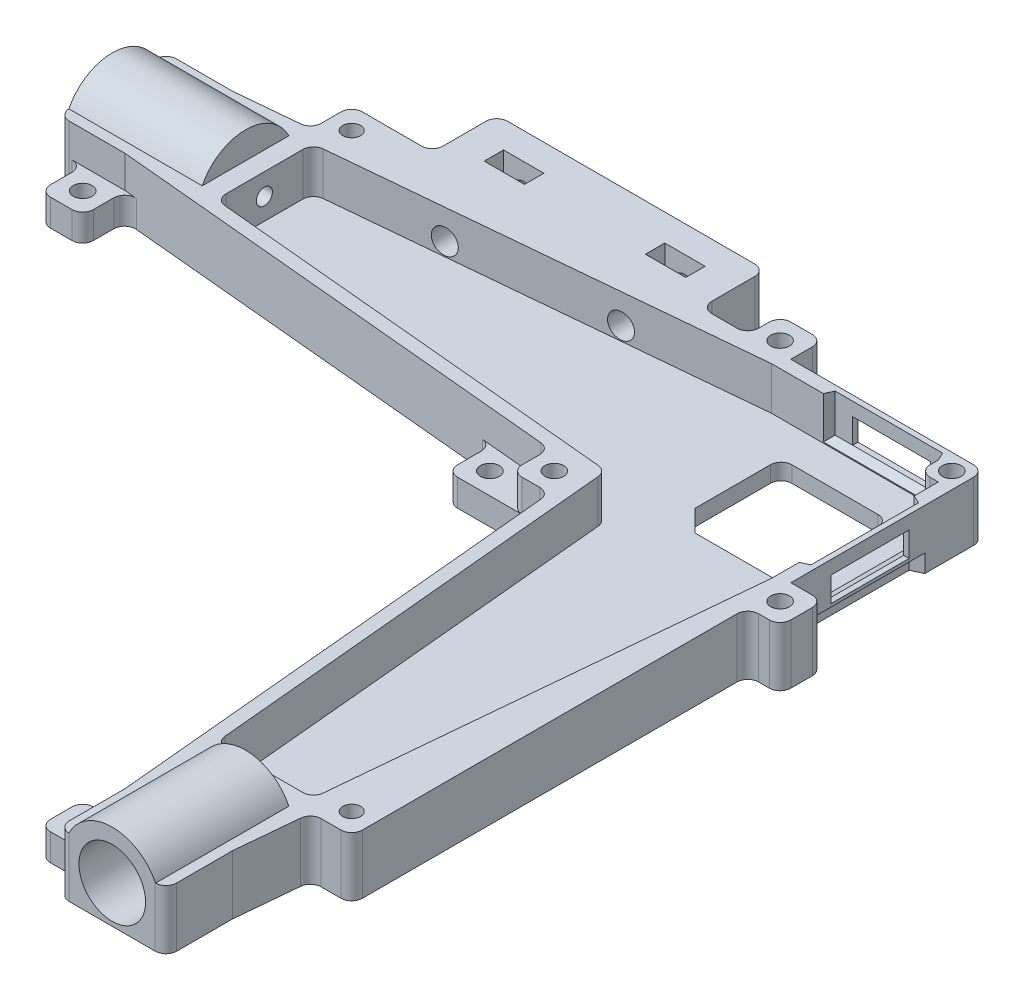
from build123d import *
from OCP.BRepFilletAPI import BRepFilletAPI_MakeChamfer

# Parameters (mm, degrees)
BOSS_EXTRUDE3_DEPTH            = 8
BOSS_EXTRUDE3_2_DEPTH          = 8
BOSS_EXTRUDE4_DEPTH            = 3
SKETCH18_W                     = 132.616225526
SKETCH18_H                     = 11
CUT_EXTRUDE4_DEPTH             = 1.5
SKETCH20_W                     = 131.116225526
SKETCH20_H                     = 11
CUT_EXTRUDE6_DEPTH             = 1.5
BOSS_EXTRUDE7_DEPTH            = 1.5
BOSS_EXTRUDE8_DEPTH            = 1.5
SKETCH17_W                     = 14.5
SKETCH17_H                     = 4.6
CUT_EXTRUDE3_DEPTH             = 202.646968735
CUT_EXTRUDE3_DIRECTION_2_REACH = 203.647
SKETCH19_W                     = 14.5
SKETCH19_H                     = 4.6
CUT_EXTRUDE5_DEPTH             = 202.646968735
CUT_EXTRUDE5_DIRECTION_2_REACH = 203.647
CUT_EXTRUDE7_START             = -1.5
SKETCH23_W                     = 20
SKETCH23_H                     = 4.6
CUT_EXTRUDE7_DEPTH             = 1.5
CUT_EXTRUDE9_START             = -1.5
SKETCH25_W                     = 20
SKETCH25_H                     = 4.6
CUT_EXTRUDE9_DEPTH             = 1.5
CHAMFER2_SIZE                  = 1.5
CHAMFER2_SIZE_2                = 0.699461487
SKETCH28_W                     = 18.5
SKETCH28_H                     = 2.4
CUT_EXTRUDE10_DEPTH            = 2
SKETCH29_W                     = 18.5
SKETCH29_H                     = 2.4
CUT_EXTRUDE11_DEPTH            = 2
CHAMFER3_SIZE                  = 0.932615316
CHAMFER3_SIZE_2                = 2
SKETCH30_W                     = 20
SKETCH30_H                     = 20
CUT_EXTRUDE12_DEPTH            = 202.684159021
FILLET1_R                      = 2
BOSS_EXTRUDE11_DEPTH           = 11
SKETCH35_R                     = 1.65
CUT_EXTRUDE13_DEPTH            = 202.825419608
CHAMFER5_SIZE                  = 4
CUT_EXTRUDE14_DEPTH            = 202.704610755
BOSS_EXTRUDE14_DEPTH           = 8
BOSS_EXTRUDE15_DEPTH           = 24.798408621
CUT_EXTRUDE22_DEPTH            = 8.18
CUT_EXTRUDE22_DEPTH_BACK       = 194.773708227
SKETCH41_R                     = 6.2
SKETCH47_R                     = 1.5
CUT_EXTRUDE24_DEPTH            = 15.799083948
BOSS_EXTRUDE16_DEPTH           = 8
BOSS_EXTRUDE17_DEPTH           = 24.798408621
CUT_EXTRUDE25_DEPTH            = 194.773708227
CUT_EXTRUDE25_DEPTH_BACK       = 8.18
SKETCH51_R                     = 6.2
SKETCH52_R                     = 1.5
CUT_EXTRUDE26_DEPTH            = 15.799083948
SKETCH53_W                     = 50
SKETCH53_H                     = 12
BOSS_EXTRUDE18_DEPTH           = 11
CUT_EXTRUDE27_REACH            = 213.11
SKETCH56_R                     = 2.3
CUT_EXTRUDE28_START            = -5
CUT_EXTRUDE28_DEPTH            = 3.6
SKETCH58_W                     = 6.050538513
SKETCH58_H                     = 6.050538513
SKETCH58_W_2                   = 8
SKETCH58_H_2                   = 6
SKETCH58_W_3                   = 6
SKETCH58_H_3                   = 8
BOSS_EXTRUDE19_DEPTH           = 11
BOSS_EXTRUDE20_DEPTH           = 5
SKETCH64_R                     = 1.75
CUT_EXTRUDE31_DEPTH            = 203.159590423
FILLET4_R                      = 2
SKETCH59_R                     = 1.75
CUT_EXTRUDE29_DEPTH            = 203.159590572
CUT_EXTRUDE30_DEPTH            = 2.5
CUT_EXTRUDE30_DRAFT            = -5
CUT_EXTRUDE30_PROFILE_2_DEPTH  = 2.5
CUT_EXTRUDE30_PROFILE_2_DRAFT  = -5


# Some blends are built 0.0001 mm under size
with BuildPart() as part:
    # Sketch10 → Boss-Extrude3 (new body)
    with BuildSketch(Plane(origin=(0, -4, 0), x_dir=(1, 0, 0), z_dir=(0, 1, 0))):
        Polygon((0, 0), (-20, 0), (-130, -10.25), (-140, -10.25), (-142.5, -10.25), (-142.5, -7.75), (-130.116225526, -7.75), (-20.116225526, 2.5), (2.5, 2.5), (2.5, -20.116225526), (-7.75, -130.116225526), (-7.75, -142.5), (-10.25, -142.5), (-10.25, -140), (-10.25, -130), (0, -20), align=None)
    extrude(amount=BOSS_EXTRUDE3_DEPTH)



with BuildPart() as body_2:
    # Sketch10 → Boss-Extrude3 2 (new body)
    with BuildSketch(Plane(origin=(0, -4, 0), x_dir=(1, 0, 0), z_dir=(0, 1, 0))):
        Polygon((-140, -25.25), (-130, -25.25), (-34.178794179, -34.178794179), (-25.25, -130), (-25.25, -140), (-25.25, -142.5), (-27.75, -142.5), (-27.75, -130.116225526), (-36.475603423, -36.475603423), (-130.116225526, -27.75), (-142.5, -27.75), (-142.5, -25.25), align=None)
    extrude(amount=BOSS_EXTRUDE3_2_DEPTH)


with BuildPart() as part_1:
    add(part.part)

    add(body_2.part)  # Boss-Extrude4 merges body 2
    # Sketch12 → Boss-Extrude4 (add)
    with BuildSketch(Plane(origin=(0, -4, 0), x_dir=(1, 0, 0), z_dir=(0, 1, 0))):
        Polygon((-142.5, -10.25), (-142.5, -25.25), (-142.5, -27.75), (-130.116225526, -27.75), (-36.475603423, -36.475603423), (-27.75, -130.116225526), (-27.75, -142.5), (-25.25, -142.5), (-10.25, -142.5), (-7.75, -142.5), (-7.75, -130.116225526), (2.5, -20.116225526), (2.5, 2.5), (-20.116225526, 2.5), (-130.116225526, -7.75), (-142.5, -7.75), align=None)
    extrude(amount=-BOSS_EXTRUDE4_DEPTH)

    # Sketch18 → Cut-Extrude4 (cut)
    with BuildSketch(Plane(origin=(0, 0, -2.5), x_dir=(-1, 0, 0), z_dir=(0, 0, -1))):
        with Locations((63.808112763, -1.5)):
            Rectangle(SKETCH18_W, SKETCH18_H)
    extrude(amount=-CUT_EXTRUDE4_DEPTH, mode=Mode.SUBTRACT)

    # Sketch20 → Cut-Extrude6 (cut)
    with BuildSketch(Plane(origin=(2.5, 0, 0), x_dir=(0, 0, -1), z_dir=(1, 0, 0))):
        with Locations((-64.558112763, -1.5)):
            Rectangle(SKETCH20_W, SKETCH20_H)
    extrude(amount=-CUT_EXTRUDE6_DEPTH, mode=Mode.SUBTRACT)

    # Sketch21 → Boss-Extrude7 (add)
    with BuildSketch(Plane.XY):
        Polygon((-20, -4), (-46.945493818, -4), (-46.945493818, 4), (-20, 4), (0, 4), (0, -4), align=None)
    extrude(amount=BOSS_EXTRUDE7_DEPTH)

    # Sketch22 → Boss-Extrude8 (add)
    with BuildSketch(Plane.ZY):
        Polygon((20, -4), (46.945493818, -4), (46.945493818, 4), (20, 4), (1.5, 4), (1.5, -4), align=None)
    extrude(amount=BOSS_EXTRUDE8_DEPTH)

    # Sketch17 → Cut-Extrude3 (cut)
    with BuildSketch(Plane.XY):
        with Locations((-15.25, -0.8)):
            Rectangle(SKETCH17_W, SKETCH17_H)
    extrude(amount=-CUT_EXTRUDE3_DEPTH, mode=Mode.SUBTRACT)

    # Sketch17 → Cut-Extrude3 direction 2 (cut, up to next)
    with BuildSketch(Plane.XY, mode=Mode.PRIVATE) as cut_extrude3_direction_2_sk1:
        with Locations((-15.25, -0.8)):
            Rectangle(SKETCH17_W, SKETCH17_H)
    cut_extrude3_direction_2_tool1 = extrude(cut_extrude3_direction_2_sk1.sketch, amount=CUT_EXTRUDE3_DIRECTION_2_REACH, mode=Mode.PRIVATE) & part_1.part
    add(cut_extrude3_direction_2_tool1.solids().sort_by_distance((-15.25, -0.8, 0))[0], mode=Mode.SUBTRACT)

    # Sketch19 → Cut-Extrude5 (cut)
    with BuildSketch(Plane(origin=(0, 0, 0), x_dir=(0, 0, -1), z_dir=(1, 0, 0))):
        with Locations((-20.25, -0.8)):
            Rectangle(SKETCH19_W, SKETCH19_H)
    extrude(amount=CUT_EXTRUDE5_DEPTH, mode=Mode.SUBTRACT)

    # Sketch19 → Cut-Extrude5 direction 2 (cut, up to next)
    with BuildSketch(Plane(origin=(0, 0, 0), x_dir=(0, 0, -1), z_dir=(1, 0, 0)), mode=Mode.PRIVATE) as cut_extrude5_direction_2_sk1:
        with Locations((-20.25, -0.8)):
            Rectangle(SKETCH19_W, SKETCH19_H)
    cut_extrude5_direction_2_tool1 = extrude(cut_extrude5_direction_2_sk1.sketch, amount=-CUT_EXTRUDE5_DIRECTION_2_REACH, mode=Mode.PRIVATE) & part_1.part
    add(cut_extrude5_direction_2_tool1.solids().sort_by_distance((0, -0.8, 20.25))[0], mode=Mode.SUBTRACT)

    # Sketch23 → Cut-Extrude7 (cut)
    with BuildSketch(Plane.ZY.offset(1.5).offset(CUT_EXTRUDE7_START)):
        with Locations((20.25, -0.8)):
            Rectangle(SKETCH23_W, SKETCH23_H)
    extrude(amount=CUT_EXTRUDE7_DEPTH, mode=Mode.SUBTRACT)

    # Sketch25 → Cut-Extrude9 (cut)
    with BuildSketch(Plane(origin=(-36, 0, 1.5), x_dir=(1, 0, 0), z_dir=(0, 0, 1)).offset(CUT_EXTRUDE9_START)):
        with Locations((20.25, -0.8)):
            Rectangle(SKETCH25_W, SKETCH25_H)
    extrude(amount=CUT_EXTRUDE9_DEPTH, mode=Mode.SUBTRACT)

    # Chamfer2
    chamfer2_edges_1 = [part_1.edges().sort_by_distance(p)[0] for p in [
        (-1.5, -3.1, 20.25),
    ]]
    chamfer2_side_1 = [part_1.faces().sort_by_distance(p)[0] for p in [
        (-1.48601077, -3.1, 20.25),
    ]]
    chamfer2_edges_2 = [part_1.edges().sort_by_distance(p)[0] for p in [
        (-1.5, -0.8, 30.25),
    ]]
    chamfer2_side_2 = [part_1.faces().sort_by_distance(p)[0] for p in [
        (-1.48601077, -0.8, 30.25),
    ]]
    chamfer2_edges_3 = [part_1.edges().sort_by_distance(p)[0] for p in [
        (-1.5, -0.8, 10.25),
    ]]
    chamfer2_side_3 = [part_1.faces().sort_by_distance(p)[0] for p in [
        (-1.48601077, -0.8, 10.25),
    ]]
    chamfer2_edges_4 = [part_1.edges().sort_by_distance(p)[0] for p in [
        (-15.75, -3.1, 1.5),
    ]]
    chamfer2_side_4 = [part_1.faces().sort_by_distance(p)[0] for p in [
        (-15.75, -3.1, 1.48601077),
    ]]
    chamfer2_edges_5 = [part_1.edges().sort_by_distance(p)[0] for p in [
        (-5.75, -0.8, 1.5),
    ]]
    chamfer2_side_5 = [part_1.faces().sort_by_distance(p)[0] for p in [
        (-5.75, -0.8, 1.48601077),
    ]]
    chamfer2_edges_6 = [part_1.edges().sort_by_distance(p)[0] for p in [
        (-25.75, -0.8, 1.5),
    ]]
    chamfer2_side_6 = [part_1.faces().sort_by_distance(p)[0] for p in [
        (-25.75, -0.8, 1.48601077),
    ]]
    chamfer2 = BRepFilletAPI_MakeChamfer(part_1.part.solid().wrapped)
    for e in chamfer2_edges_1:
        chamfer2.Add(CHAMFER2_SIZE - 0.0001, CHAMFER2_SIZE_2 - 0.0001, e.wrapped, chamfer2_side_1[0].wrapped)
    for e in chamfer2_edges_2:
        chamfer2.Add(CHAMFER2_SIZE - 0.0001, CHAMFER2_SIZE_2 - 0.0001, e.wrapped, chamfer2_side_2[0].wrapped)
    for e in chamfer2_edges_3:
        chamfer2.Add(CHAMFER2_SIZE - 0.0001, CHAMFER2_SIZE_2 - 0.0001, e.wrapped, chamfer2_side_3[0].wrapped)
    for e in chamfer2_edges_4:
        chamfer2.Add(CHAMFER2_SIZE - 0.0001, CHAMFER2_SIZE_2 - 0.0001, e.wrapped, chamfer2_side_4[0].wrapped)
    for e in chamfer2_edges_5:
        chamfer2.Add(CHAMFER2_SIZE - 0.0001, CHAMFER2_SIZE_2 - 0.0001, e.wrapped, chamfer2_side_5[0].wrapped)
    for e in chamfer2_edges_6:
        chamfer2.Add(CHAMFER2_SIZE - 0.0001, CHAMFER2_SIZE_2 - 0.0001, e.wrapped, chamfer2_side_6[0].wrapped)
    add(Compound.cast(chamfer2.Shape()), mode=Mode.REPLACE)  # a hair under: the kernel refuses the full size

    # Sketch28 → Cut-Extrude10 (cut)
    with BuildSketch(Plane(origin=(0, 0, -1), x_dir=(-1, 0, 0), z_dir=(0, 0, -1))):
        with Locations((15.25, -5.8)):
            Rectangle(SKETCH28_W, SKETCH28_H)
    extrude(amount=-CUT_EXTRUDE10_DEPTH, mode=Mode.SUBTRACT)

    # Sketch29 → Cut-Extrude11 (cut)
    with BuildSketch(Plane(origin=(1, 0, 5), x_dir=(0, 0, 1), z_dir=(-1, 0, 0))):
        with Locations((15.25, -5.8)):
            Rectangle(SKETCH29_W, SKETCH29_H)
    extrude(amount=CUT_EXTRUDE11_DEPTH, mode=Mode.SUBTRACT)

    # Chamfer3
    chamfer3_edges_1 = [part_1.edges().sort_by_distance(p)[0] for p in [
        (-24.5, -5.8, -1),
    ]]
    chamfer3_side_1 = [part_1.faces().sort_by_distance(p)[0] for p in [
        (-24.518652306, -5.8, -1),
    ]]
    chamfer3_edges_2 = [part_1.edges().sort_by_distance(p)[0] for p in [
        (-15.25, -4.6, -1),
    ]]
    chamfer3_side_2 = [part_1.faces().sort_by_distance(p)[0] for p in [
        (-15.25, -4.581347694, -1),
    ]]
    chamfer3_edges_3 = [part_1.edges().sort_by_distance(p)[0] for p in [
        (-6, -5.8, -1),
    ]]
    chamfer3_side_3 = [part_1.faces().sort_by_distance(p)[0] for p in [
        (-5.981347694, -5.8, -1),
    ]]
    chamfer3_edges_4 = [part_1.edges().sort_by_distance(p)[0] for p in [
        (1, -5.8, 11),
    ]]
    chamfer3_side_4 = [part_1.faces().sort_by_distance(p)[0] for p in [
        (1, -5.8, 10.981347694),
    ]]
    chamfer3_edges_5 = [part_1.edges().sort_by_distance(p)[0] for p in [
        (1, -5.8, 29.5),
    ]]
    chamfer3_side_5 = [part_1.faces().sort_by_distance(p)[0] for p in [
        (1, -5.8, 29.518652306),
    ]]
    chamfer3_edges_6 = [part_1.edges().sort_by_distance(p)[0] for p in [
        (1, -4.6, 20.25),
    ]]
    chamfer3_side_6 = [part_1.faces().sort_by_distance(p)[0] for p in [
        (1, -4.581347694, 20.25),
    ]]
    chamfer3 = BRepFilletAPI_MakeChamfer(part_1.part.solid().wrapped)
    for e in chamfer3_edges_1:
        chamfer3.Add(CHAMFER3_SIZE - 0.0001, CHAMFER3_SIZE_2 - 0.0001, e.wrapped, chamfer3_side_1[0].wrapped)
    for e in chamfer3_edges_2:
        chamfer3.Add(CHAMFER3_SIZE - 0.0001, CHAMFER3_SIZE_2 - 0.0001, e.wrapped, chamfer3_side_2[0].wrapped)
    for e in chamfer3_edges_3:
        chamfer3.Add(CHAMFER3_SIZE - 0.0001, CHAMFER3_SIZE_2 - 0.0001, e.wrapped, chamfer3_side_3[0].wrapped)
    for e in chamfer3_edges_4:
        chamfer3.Add(CHAMFER3_SIZE - 0.0001, CHAMFER3_SIZE_2 - 0.0001, e.wrapped, chamfer3_side_4[0].wrapped)
    for e in chamfer3_edges_5:
        chamfer3.Add(CHAMFER3_SIZE - 0.0001, CHAMFER3_SIZE_2 - 0.0001, e.wrapped, chamfer3_side_5[0].wrapped)
    for e in chamfer3_edges_6:
        chamfer3.Add(CHAMFER3_SIZE - 0.0001, CHAMFER3_SIZE_2 - 0.0001, e.wrapped, chamfer3_side_6[0].wrapped)
    add(Compound.cast(chamfer3.Shape()), mode=Mode.REPLACE)  # a hair under: the kernel refuses the full size

    # Sketch30 → Cut-Extrude12 (cut, through all)
    with BuildSketch(Plane(origin=(0, -4, 0), x_dir=(1, 0, 0), z_dir=(0, 1, 0))):
        with Locations((-17.899660586, -17.899660586)):
            Rectangle(SKETCH30_W, SKETCH30_H)
    extrude(amount=-CUT_EXTRUDE12_DEPTH, mode=Mode.SUBTRACT)

    # Fillet1
    fillet1_edges = [part_1.edges().sort_by_distance(p)[0] for p in [
        (-27.899660586, -5.5, 7.899660586),
        (-7.899660586, -5.5, 7.899660586),
        (-7.899660586, -5.5, 27.899660586),
    ]]
    fillet(fillet1_edges, radius=FILLET1_R)

    # Sketch33 → Boss-Extrude11 (add)
    with BuildSketch(Plane.XZ.offset(7)):
        Polygon((-36.213786501, -1), (-116.701591379, -1), (-116.701591379, 6.5), align=None)
        Polygon((1, 116.701591379), (-6.5, 116.701591379), (1, 36.213786501), align=None)
    extrude(amount=-BOSS_EXTRUDE11_DEPTH)

    # Sketch35 → Cut-Extrude13 (cut, through all)
    with BuildSketch(Plane(origin=(0, 4, 0), x_dir=(1, 0, 0), z_dir=(0, 1, 0))):
        with Locations(Location((-112.701591379, -3, 0), (0, 0, 270))):
            Circle(SKETCH35_R)
        with Locations(Location((-3, -112.701591379, 0), (0, 0, 90))):
            Circle(SKETCH35_R)
    extrude(amount=-CUT_EXTRUDE13_DEPTH, mode=Mode.SUBTRACT)

    # Chamfer5
    chamfer5_edges = [part_1.edges().sort_by_distance(p)[0] for p in [
        (-27.899660586, -5.5, 27.899660586),
    ]]
    chamfer(chamfer5_edges, length=CHAMFER5_SIZE)

    # Sketch37 → Cut-Extrude14 (cut, through all)
    with BuildSketch(Plane.XZ.offset(-1.5)):
        Polygon((0, 27.5), (0, 30.25), (-1.5, 30.949461487), (-1.5, 9.550538513), (0, 10.25), (0, 13), align=None)
        Polygon((-25.75, 0), (-22.5, 0), (-8, 0), (-5.75, 0), (-5.050538513, 1.5), (-26.449461487, 1.5), align=None)
    extrude(amount=-CUT_EXTRUDE14_DEPTH, mode=Mode.SUBTRACT)

    # Sketch44 → Boss-Extrude14 (add)
    with BuildSketch(Plane(origin=(0, -4, 0), x_dir=(1, 0, 0), z_dir=(0, 1, 0))):
        Polygon((-114.200916052, -8.777812632), (-114.200916052, -26.722187368), (-130, -25.25), (-142.5, -25.25), (-142.5, -10.25), (-130, -10.25), align=None)
    extrude(amount=BOSS_EXTRUDE14_DEPTH)

    # Sketch46 → Boss-Extrude15 (add)
    with BuildSketch(Plane.ZY.offset(142.5)):
        with BuildLine():
            Line((9.687742252, 4), (25.812257748, 4))
            ThreePointArc((25.812257748, 4), (17.75, 9), (9.687742252, 4))
        make_face()
    extrude(amount=-BOSS_EXTRUDE15_DEPTH)

    # Sketch41 → Cut-Extrude22 (cut, two sides: drawn at the far end of the back side and taken through both)
    with BuildSketch(Plane(origin=(-130, 0, 0), x_dir=(0, 0, -1), z_dir=(1, 0, 0)).offset(-CUT_EXTRUDE22_DEPTH_BACK)):
        with Locations((-17.75, 0)):
            Circle(SKETCH41_R)
    extrude(amount=CUT_EXTRUDE22_DEPTH + CUT_EXTRUDE22_DEPTH_BACK, mode=Mode.SUBTRACT)

    # Sketch47 → Cut-Extrude24 (cut)
    with BuildSketch(Plane(origin=(-130, 0, 0), x_dir=(0, 0, -1), z_dir=(1, 0, 0))):
        with Locations(Location((-17.75, 0, 0), (0, 0, 180))):
            Circle(SKETCH47_R)
    extrude(amount=CUT_EXTRUDE24_DEPTH, mode=Mode.SUBTRACT)

    # Sketch48 → Boss-Extrude16 (add)
    with BuildSketch(Plane(origin=(0, -4, 0), x_dir=(1, 0, 0), z_dir=(0, 1, 0))):
        Polygon((-25.25, -142.5), (-10.25, -142.5), (-10.25, -130), (-8.777812632, -114.200916052), (-26.722187368, -114.200916052), (-25.25, -130), align=None)
    extrude(amount=BOSS_EXTRUDE16_DEPTH)

    # Sketch49 → Boss-Extrude17 (add)
    with BuildSketch(Plane.XY.offset(142.5)):
        with BuildLine():
            Line((-25.812257748, 4), (-9.687742252, 4))
            ThreePointArc((-9.687742252, 4), (-17.75, 9), (-25.812257748, 4))
        make_face()
    extrude(amount=-BOSS_EXTRUDE17_DEPTH)

    # Sketch51 → Cut-Extrude25 (cut, two sides: drawn at the far end of the back side and taken through both)
    with BuildSketch(Plane.XY.offset(130).offset(-CUT_EXTRUDE25_DEPTH_BACK)):
        with Locations((-17.75, 0)):
            Circle(SKETCH51_R)
    extrude(amount=CUT_EXTRUDE25_DEPTH + CUT_EXTRUDE25_DEPTH_BACK, mode=Mode.SUBTRACT)

    # Sketch52 → Cut-Extrude26 (cut)
    with BuildSketch(Plane.XY.offset(130)):
        with Locations((-17.75, 0)):
            Circle(SKETCH52_R)
    extrude(amount=-CUT_EXTRUDE26_DEPTH, mode=Mode.SUBTRACT)

    # Sketch53 → Boss-Extrude18 (add)
    with BuildSketch(Plane.XZ.offset(7)):
        with Locations((-76.701591379, -7)):
            Rectangle(SKETCH53_W, SKETCH53_H)
    extrude(amount=-BOSS_EXTRUDE18_DEPTH)

    # Cut-Extrude27: up to this plane
    cut_extrude27_end = Plane(origin=(-20, 209.060966544, 0), z_dir=(-0.09277989176383615, 0, -0.9956866433192176))
    # Sketch56 → Cut-Extrude27 (cut, up to the surface)
    with BuildSketch(Plane(origin=(0, 0, -13), x_dir=(-1, 0, 0), z_dir=(0, 0, -1)), mode=Mode.PRIVATE) as cut_extrude27_sk1:
        with Locations((61.701591379, -1.5)):
            Circle(SKETCH56_R)
    cut_extrude27_tool1 = split(extrude(cut_extrude27_sk1.sketch, amount=-CUT_EXTRUDE27_REACH, mode=Mode.PRIVATE), bisect_by=cut_extrude27_end, keep=Keep.BOTH, mode=Mode.PRIVATE)
    add(cut_extrude27_tool1.solids().sort_by_distance((-61.701591, -1.5, -13))[0], mode=Mode.SUBTRACT)
    # Sketch56 → Cut-Extrude27 (cut, up to the surface)
    with BuildSketch(Plane(origin=(0, 0, -13), x_dir=(-1, 0, 0), z_dir=(0, 0, -1)), mode=Mode.PRIVATE) as cut_extrude27_sk2:
        with Locations(Location((91.701591379, -1.5, 0), (0, 0, 180))):
            Circle(SKETCH56_R)
    cut_extrude27_tool2 = split(extrude(cut_extrude27_sk2.sketch, amount=-CUT_EXTRUDE27_REACH, mode=Mode.PRIVATE), bisect_by=cut_extrude27_end, keep=Keep.BOTH, mode=Mode.PRIVATE)
    add(cut_extrude27_tool2.solids().sort_by_distance((-91.701591, -1.5, -13))[0], mode=Mode.SUBTRACT)

    # Sketch57 → Cut-Extrude28 (cut)
    with BuildSketch(Plane(origin=(0, 0, -13), x_dir=(-1, 0, 0), z_dir=(0, 0, -1)).offset(CUT_EXTRUDE28_START)):
        Polygon((57.951591379, 0.665063509), (57.951591379, 4), (65.451591379, 4), (65.451591379, 0.665063509), (65.451591379, -3.665063509), (61.701591379, -5.830127019), (57.951591379, -3.665063509), align=None)
        Polygon((87.951591379, 4), (87.951591379, 0.665063509), (87.951591379, -3.665063509), (91.701591379, -5.830127019), (95.451591379, -3.665063509), (95.451591379, 0.665063509), (95.451591379, 4), align=None)
    extrude(amount=-CUT_EXTRUDE28_DEPTH, mode=Mode.SUBTRACT)

    # Sketch58 → Boss-Extrude19 (add)
    with BuildSketch(Plane(origin=(0, -7, 0), x_dir=(-1, 0, 0), z_dir=(0, -1, 0))):
        with Locations((2.025269257, -2.025269257)):
            Rectangle(SKETCH58_W, SKETCH58_H)
        with Locations((39, 4)):
            Rectangle(SKETCH58_W_2, SKETCH58_H_2)
        Polygon((43, -35.867648288), (36.475603423, -36.475603423), (35.867648288, -43), (43, -43), align=None)
        with Locations((-4, -39)):
            Rectangle(SKETCH58_W_3, SKETCH58_H_3)
    extrude(amount=-BOSS_EXTRUDE19_DEPTH)

    # Sketch62 → Boss-Extrude20 (add)
    with BuildSketch(Plane.XZ.offset(7)):
        Polygon((-43, 35.867648288), (-43, 43), (-55, 43), (-55, 34.749466469), align=None)
        Polygon((-138, 27.75), (-138, 35.75), (-130, 35.75), (-130, 27.760830106), (-130.116225526, 27.75), align=None)
        Polygon((-27.75, 130.116225526), (-27.75, 138), (-35.75, 138), (-35.75, 130), (-27.760830106, 130), align=None)
    extrude(amount=-BOSS_EXTRUDE20_DEPTH)

    # Sketch64 → Cut-Extrude31 (cut, through all)
    with BuildSketch(Plane.XZ.offset(7)):
        with Locations(Location((-134, 31.75, 0), (0, 0, 270))):
            Circle(SKETCH64_R)
        with Locations(Location((-51, 39, 0), (0, 0, 270))):
            Circle(SKETCH64_R)
        with Locations(Location((-31.75, 134, 0), (0, 0, 270))):
            Circle(SKETCH64_R)
    extrude(amount=-CUT_EXTRUDE31_DEPTH, mode=Mode.SUBTRACT)

    # Fillet4
    # the kernel refuses this fillet: 2 mm, written as the material it adds along each edge
    with BuildSketch(Plane(origin=(-116.701591379, -7, 6.5), x_dir=(0, 0, -1), z_dir=(0, 1, 0)), Plane(origin=(-6.5, -7, 116.701591379), x_dir=(-0.09277989176380903, 0, 0.9956866433192202), z_dir=(0, 1, 0)), Plane(origin=(-35.867648288, -7, 43), x_dir=(-1, 0, 0), z_dir=(0, 1, 0))) as fillet4_piece_1:
        with BuildLine():
            CenterArc((FILLET4_R * 0.911150224143, FILLET4_R), FILLET4_R, 185.323552552, 84.676447448)
            Line((-FILLET4_R * 0.0845364191766, FILLET4_R * 0.907220108236), (0, 0))
            Line((0, 0), (FILLET4_R * 0.911150224143, 0))
        make_face()
    extrude(amount=11)
    with BuildSketch(Plane(origin=(-114.200916052, -4, 8.777812632), x_dir=(0.9956866433192175, 0, -0.09277989176383705), z_dir=(0, 1, 0)), Plane(origin=(-114.200916052, -4, 26.722187368), x_dir=(0, 0, -1), z_dir=(0, 1, 0)), Plane(origin=(-8.777812632, -4, 114.200916052), x_dir=(-1, 0, 0), z_dir=(0, 1, 0)), Plane(origin=(-26.722187368, -4, 114.200916052), x_dir=(-0.09277989176383343, 0, -0.9956866433192179), z_dir=(0, 1, 0))) as fillet4_piece_2:
        with BuildLine():
            CenterArc((FILLET4_R * 0.911150224143, -FILLET4_R), FILLET4_R, 90, 84.676447448)
            Line((-FILLET4_R * 0.0845364191766, -FILLET4_R * 0.907220108236), (0, 0))
            Line((0, 0), (FILLET4_R * 0.911150224143, 0))
        make_face()
    extrude(amount=8)
    with BuildSketch(Plane(origin=(-51.701591379, -7, -1), x_dir=(0, 0, -1), z_dir=(0, 1, 0)), Plane(origin=(-101.701591379, -7, -1), x_dir=(-1, 0, 0), z_dir=(0, 1, 0)), Plane(origin=(-43, -7, -1), x_dir=(-1, 0, 0), z_dir=(0, 1, 0))) as fillet4_piece_3:
        with BuildLine():
            CenterArc((FILLET4_R, -FILLET4_R), FILLET4_R, 90, 90)
            Line((0, -FILLET4_R), (0, 0))
            Line((0, 0), (FILLET4_R, 0))
        make_face()
    extrude(amount=11)
    with BuildSketch(Plane(origin=(-43, -6.555751121, 35.867648288), x_dir=(-0.9956866433192175, 0, -0.0927798917638368), z_dir=(0, 1, 0))) as fillet4_piece_4:
        with BuildLine():
            CenterArc((FILLET4_R * 0.911150224143, FILLET4_R), FILLET4_R, 185.323552552, 84.676447448)
            Line((-FILLET4_R * 0.0845364191766, FILLET4_R * 0.907220108236), (0, 0))
            Line((0, 0), (FILLET4_R * 0.911150224143, 0))
        make_face()
    extrude(amount=10.555751121)
    with BuildSketch(Plane(origin=(1, -7, 43), x_dir=(0, 0, 1), z_dir=(0, 1, 0))) as fillet4_piece_5:
        with BuildLine():
            CenterArc((FILLET4_R, FILLET4_R), FILLET4_R, 180, 90)
            Line((0, FILLET4_R), (0, 0))
            Line((0, 0), (FILLET4_R, 0))
        make_face()
    extrude(amount=11)
    with BuildSketch(Plane(origin=(-55, -7, 34.749466469), x_dir=(-0.9956866433192179, 0, -0.09277989176383329), z_dir=(0, 1, 0))) as fillet4_piece_6:
        with BuildLine():
            CenterArc((FILLET4_R * 0.911150224143, FILLET4_R), FILLET4_R, 185.323552552, 84.676447448)
            Line((-FILLET4_R * 0.0845364191766, FILLET4_R * 0.907220108236), (0, 0))
            Line((0, 0), (FILLET4_R * 0.911150224143, 0))
        make_face()
    extrude(amount=5)
    with BuildSketch(Plane(origin=(-130.116225526, -2.232451052, 27.75), x_dir=(-1, 0, 0), z_dir=(0, 1, 0))) as fillet4_piece_7:
        with BuildLine():
            CenterArc((FILLET4_R * 0.0464902103115, FILLET4_R), FILLET4_R, 264.676447448, 5.323552552)
            Line((-FILLET4_R * 0.0462896814523, FILLET4_R * 0.00431335668078), (0, 0))
            Line((0, 0), (FILLET4_R * 0.0464902103115, 0))
        make_face()
    extrude(amount=6.232451052)
    with BuildSketch(Plane(origin=(-138, -7, 27.75), x_dir=(-1, 0, 0), z_dir=(0, 1, 0)), Plane(origin=(-27.75, -7, 138), x_dir=(-1, 0, 0), z_dir=(0, 1, 0))) as fillet4_piece_8:
        with BuildLine():
            CenterArc((FILLET4_R, FILLET4_R), FILLET4_R, 180, 90)
            Line((0, FILLET4_R), (0, 0))
            Line((0, 0), (FILLET4_R, 0))
        make_face()
    extrude(amount=5)
    with BuildSketch(Plane(origin=(-130, -7, 27.760830106), x_dir=(0, 0, 1), z_dir=(0, 1, 0)), Plane(origin=(-27.760830106, -7, 130), x_dir=(-0.09277989176382276, 0, -0.9956866433192189), z_dir=(0, 1, 0))) as fillet4_piece_9:
        with BuildLine():
            CenterArc((FILLET4_R * 1.09751386051, FILLET4_R), FILLET4_R, 174.676447448, 95.323552552)
            Line((FILLET4_R * 0.101827217187, FILLET4_R * 1.09277989176), (0, 0))
            Line((0, 0), (FILLET4_R * 1.09751386051, 0))
        make_face()
    extrude(amount=5)
    with BuildSketch(Plane(origin=(-27.75, 4, 130.116225526), x_dir=(-0.09277989176383894, 0, -0.9956866433192174), z_dir=(0, -1, 0))) as fillet4_piece_10:
        with BuildLine():
            CenterArc((FILLET4_R * 0.0464902103115, -FILLET4_R), FILLET4_R, 90, 5.323552552)
            Line((-FILLET4_R * 0.0462896814523, -FILLET4_R * 0.00431335668078), (0, 0))
            Line((0, 0), (FILLET4_R * 0.0464902103115, 0))
        make_face()
    extrude(amount=6.232451052)
    # the kernel refuses this fillet: 2 mm, written as the material it takes off along each edge
    with BuildSketch(Plane(origin=(1, 9, -1), x_dir=(-1, 0, 0), z_dir=(0, -1, 0)), Plane(origin=(-7.75, -12, 142.5), x_dir=(-1, 0, 0), z_dir=(0, 1, 0)), Plane(origin=(-116.701591379, -12, -1), x_dir=(1, 0, 0), z_dir=(0, 1, 0)), Plane(origin=(1, -12, 116.701591379), x_dir=(-1, 0, 0), z_dir=(0, 1, 0)), Plane(origin=(-142.5, -12, 27.75), x_dir=(0, 0, -1), z_dir=(0, 1, 0)), Plane(origin=(7, -12, 43), x_dir=(-1, 0, 0), z_dir=(0, 1, 0))) as fillet4_2_piece_1:
        with BuildLine():
            CenterArc((FILLET4_R, -FILLET4_R), FILLET4_R, 90, 90)
            Line((0, -FILLET4_R), (0, 0))
            Line((0, 0), (FILLET4_R, 0))
        make_face()
    extrude(amount=21, mode=Mode.SUBTRACT)
    with BuildSketch(Plane(origin=(-27.75, 9, 142.5), x_dir=(0, 0, -1), z_dir=(0, -1, 0)), Plane(origin=(-142.5, 9, 7.75), x_dir=(1, 0, 0), z_dir=(0, -1, 0)), Plane(origin=(-101.701591379, -12, -13), x_dir=(0, 0, 1), z_dir=(0, 1, 0)), Plane(origin=(-51.701591379, -12, -13), x_dir=(-1, 0, 0), z_dir=(0, 1, 0)), Plane(origin=(-35, -12, -7), x_dir=(-1, 0, 0), z_dir=(0, 1, 0)), Plane(origin=(-43, -12, -7), x_dir=(0, 0, 1), z_dir=(0, 1, 0)), Plane(origin=(7, -12, 35), x_dir=(-1, 0, 0), z_dir=(0, 1, 0))) as fillet4_2_piece_2:
        with BuildLine():
            CenterArc((FILLET4_R, FILLET4_R), FILLET4_R, 180, 90)
            Line((0, FILLET4_R), (0, 0))
            Line((0, 0), (FILLET4_R, 0))
        make_face()
    extrude(amount=21, mode=Mode.SUBTRACT)
    with BuildSketch(Plane(origin=(-5.050538513, -4, 5.050538513), x_dir=(1, 0, 0), z_dir=(0, 1, 0))) as fillet4_2_piece_3:
        with BuildLine():
            CenterArc((FILLET4_R, FILLET4_R), FILLET4_R, 180, 90)
            Line((0, FILLET4_R), (0, 0))
            Line((0, 0), (FILLET4_R, 0))
        make_face()
    extrude(amount=13, mode=Mode.SUBTRACT)
    with BuildSketch(Plane(origin=(-43, -2, 43), x_dir=(1, 0, 0), z_dir=(0, 1, 0))) as fillet4_2_piece_4:
        with BuildLine():
            CenterArc((FILLET4_R, FILLET4_R), FILLET4_R, 180, 90)
            Line((0, FILLET4_R), (0, 0))
            Line((0, 0), (FILLET4_R, 0))
        make_face()
    extrude(amount=11, mode=Mode.SUBTRACT)
    with BuildSketch(Plane(origin=(-55, -12, 43), x_dir=(0, 0, -1), z_dir=(0, 1, 0)), Plane(origin=(-138, -12, 35.75), x_dir=(0, 0, -1), z_dir=(0, 1, 0)), Plane(origin=(-130, -12, 35.75), x_dir=(-1, 0, 0), z_dir=(0, 1, 0)), Plane(origin=(-35.75, -12, 130), x_dir=(1, 0, 0), z_dir=(0, 1, 0)), Plane(origin=(-35.75, -12, 138), x_dir=(0, 0, -1), z_dir=(0, 1, 0))) as fillet4_2_piece_5:
        with BuildLine():
            CenterArc((FILLET4_R, -FILLET4_R), FILLET4_R, 90, 90)
            Line((0, -FILLET4_R), (0, 0))
            Line((0, 0), (FILLET4_R, 0))
        make_face()
    extrude(amount=15, mode=Mode.SUBTRACT)
    with BuildSketch(Plane(origin=(-34.178794179, -4, 34.178794179), x_dir=(-0.9956866433192174, 0, -0.09277989176383847), z_dir=(0, 1, 0))) as fillet4_2_piece_6:
        with BuildLine():
            CenterArc((FILLET4_R * 0.829521829522, FILLET4_R), FILLET4_R, 190.647105104, 79.352894896)
            Line((-FILLET4_R * 0.153261953847, FILLET4_R * 0.815240602004), (0, 0))
            Line((0, 0), (FILLET4_R * 0.829521829522, 0))
        make_face()
    extrude(amount=12.147609148, mode=Mode.SUBTRACT)

    # Sketch59 → Cut-Extrude29 (cut, through all)
    with BuildSketch(Plane.XZ.offset(7)):
        with Locations(Location((-39, -3, 0), (0, 0, 270))):
            Circle(SKETCH59_R)
        with Locations(Location((-39, 39, 0), (0, 0, 270))):
            Circle(SKETCH59_R)
        with Locations(Location((3, 39, 0), (0, 0, 270))):
            Circle(SKETCH59_R)
        with Locations(Location((-2.025269256, 2.025269256, 0), (0, 0, 270))):
            Circle(SKETCH59_R)
    extrude(amount=-CUT_EXTRUDE29_DEPTH, mode=Mode.SUBTRACT)


with BuildPart() as cut_extrude30_tool:
    # Sketch60 → Cut-Extrude30 (with draft: the straight prism first)
    with BuildSketch(Plane.XZ.offset(7)):
        Polygon((-111.864787605, -0.122994201), (-109.578597179, 2.163196226), (-110.415400953, 5.286190427), (-113.538395153, 6.122994201), (-115.82458558, 3.836803774), (-114.987781806, 0.713809573), align=None)
    extrude(amount=-CUT_EXTRUDE30_DEPTH)
    # Cut-Extrude30: the draft: its side faces are tilted about the plane it starts from
    cut_extrude30_sides = [cut_extrude30_tool.faces().sort_by_distance(p)[0] for p in [
        (-110.721692392, -5.75, 1.020101013),
        (-109.996999066, -5.75, 3.724693326),
        (-111.976898053, -5.75, 5.704592314),
        (-114.681490367, -5.75, 4.979898987),
        (-115.406183693, -5.75, 2.275306674),
        (-113.426284706, -5.75, 0.295407686),
    ]]
    draft(cut_extrude30_sides, Plane.XZ.offset(7), CUT_EXTRUDE30_DRAFT)


with BuildPart() as part_2:
    add(part_1.part)

    # Cut-Extrude30: cut by cut_extrude30_tool
    add(cut_extrude30_tool.part, mode=Mode.SUBTRACT)


with BuildPart() as cut_extrude30_profile_2_tool:
    # Sketch60 → Cut-Extrude30 profile 2 (with draft: the straight prism first)
    with BuildSketch(Plane.XZ.offset(7)):
        Polygon((-2.163196226, 109.578597179), (0.122994201, 111.864787605), (-0.713809573, 114.987781806), (-3.836803774, 115.82458558), (-6.122994201, 113.538395153), (-5.286190427, 110.415400953), align=None)
    extrude(amount=-CUT_EXTRUDE30_PROFILE_2_DEPTH)
    # Cut-Extrude30 profile 2: the draft: its side faces are tilted about the plane it starts from
    cut_extrude30_profile_2_sides = [cut_extrude30_profile_2_tool.faces().sort_by_distance(p)[0] for p in [
        (-1.020101013, -5.75, 110.721692392),
        (-0.295407686, -5.75, 113.426284706),
        (-2.275306674, -5.75, 115.406183693),
        (-4.979898987, -5.75, 114.681490367),
        (-5.704592314, -5.75, 111.976898053),
        (-3.724693326, -5.75, 109.996999066),
    ]]
    draft(cut_extrude30_profile_2_sides, Plane.XZ.offset(7), CUT_EXTRUDE30_PROFILE_2_DRAFT)


with BuildPart() as part_3:
    add(part_2.part)

    # Cut-Extrude30 profile 2: cut by cut_extrude30_profile_2_tool
    add(cut_extrude30_profile_2_tool.part, mode=Mode.SUBTRACT)


solid = part_3.part
